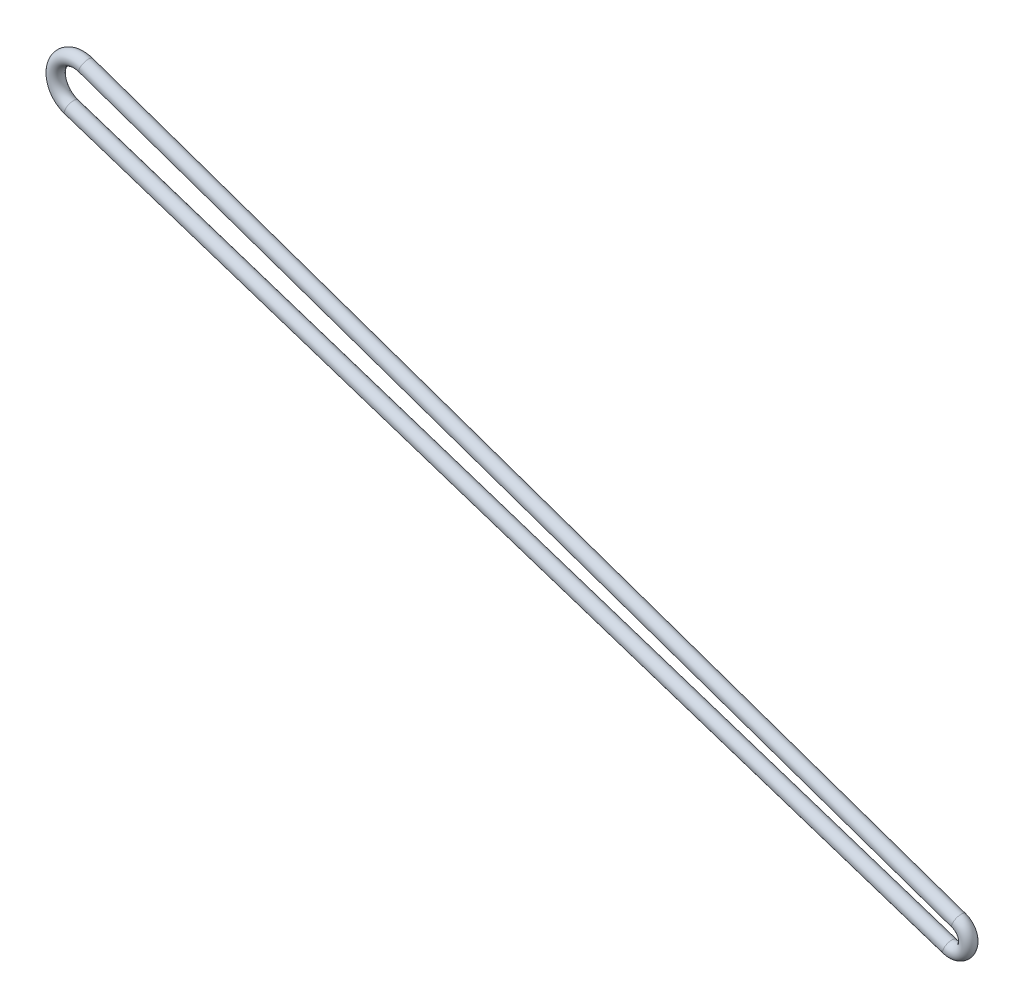
from build123d import *

# Parameters (mm, degrees)
SWEEP_19_PROFILE_R = 1.5


with BuildPart() as part:
    # 扫描19: sweep along a path in 草图2
    with BuildLine(Plane.XY) as sweep_19_path:
        Line((316.680584132, 89.14006929), (124.461225813, 152.102308845))
        ThreePointArc((124.461225813, 152.102308845), (121.280867415, 158.454865227), (127.663016793, 161.575413489))
        Line((127.663016793, 161.575413489), (318.665694539, 95.013394169))
        ThreePointArc((318.665694539, 95.013394169), (320.582345921, 91.093456261), (316.680584132, 89.14006929))
    # 扫描19 profile (on start of the path) → 扫描19 (sweep)
    with BuildSketch(Plane(origin=(316.680584132, 89.14006929, 0), x_dir=(-0.31128057773305, -0.9503180530360237, 0), z_dir=(-0.9503180530360237, 0.31128057773305, 0))):
        Circle(SWEEP_19_PROFILE_R)
    sweep(path=sweep_19_path.line)


solid = part.part
